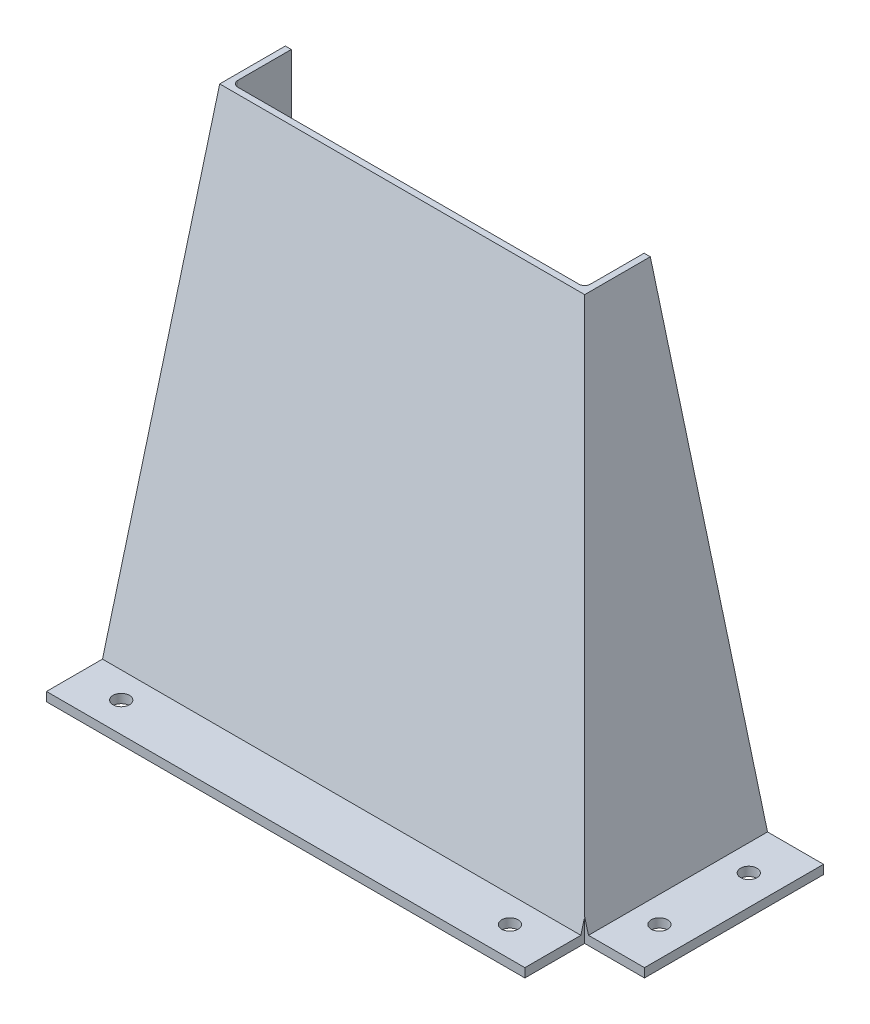
from build123d import *

# Parameters (mm, degrees)
SHELL1_START        = -169
SHELL1_DEPTH        = 196.698454184
BOSS_EXTRUDE1_REACH = 223.544
SKETCH5_W           = 20
SKETCH5_H           = 3
SKETCH6_W           = 20
SKETCH6_H           = 3
BOSS_EXTRUDE2_DEPTH = 79.88011004
CUT_EXTRUDE1_REACH  = 187.712
SKETCH7_W           = 20
SKETCH7_H           = 20
BOSS_EXTRUDE3_DEPTH = 2
FILLET1_R           = 2
CUT_EXTRUDE2_REACH  = 187.712
SKETCH9_R           = 2.75


with BuildPart() as part:
    # Loft1: read off the stored shape, not the designer's step
    # Loft1: loft between two sections, ruled curve by curve
    loft1_from = [
        Edge.make_line((40.035, 150, -9.025), (-80.035, 150, -9.025)),
        Edge.make_line((-80.035, 150, -9.025), (-80.035, 150, -30.975)),
        Edge.make_line((40.035, 150, -30.975), (40.035, 150, -9.025)),
        Edge.make_line((-80.035, 150, -30.975), (40.035, 150, -30.975)),
    ]
    loft1_to = [
        Edge.make_line((80.035, 0, 30.975), (-80.035, 0, 30.975)),
        Edge.make_line((-80.035, 0, 30.975), (-80.035, 0, -30.975)),
        Edge.make_line((80.035, 0, -30.975), (80.035, 0, 30.975)),
        Edge.make_line((-80.035, 0, -30.975), (80.035, 0, -30.975)),
    ]
    loft1 = Solid(Shell([*[Face.make_surface_from_curves(loft1_from[k], loft1_to[k]) for k in range(4)], Face(Wire(loft1_from)), Face(Wire(loft1_to))]))
    add(loft1)

    # Shell1: read off the stored shape, not the designer's step
    # Shell1 outline → Shell1 (cut)
    with BuildSketch(Plane(origin=(0, 0, 0), x_dir=(0.9683714115263207, 0.24108831822232024, -0.06429021819261868), z_dir=(0.2495131446207219, -0.935674292327708, 0.2495131446207219)).offset(SHELL1_START)):
        Polygon((73.640867828, 27.929127254), (-81, 27.929127254), (-81, -31), (77.561825655, -31), (77.490573168, -29.929127254), align=None)
    extrude(amount=SHELL1_DEPTH, mode=Mode.SUBTRACT)

    # Boss-Extrude1: up to this plane
    boss_extrude1_end = Plane(origin=(74.721473029, 19.925726141, 0), z_dir=(0.9662349396012464, 0.2576626505603324, 0))
    # Sketch5 → Boss-Extrude1 (add, up to the surface)
    with BuildSketch(Plane.ZY.offset(80.035), mode=Mode.PRIVATE) as boss_extrude1_sk1:
        with Locations((38.90511004, 1.5)):
            Rectangle(SKETCH5_W, SKETCH5_H)
    boss_extrude1_tool1 = split(extrude(boss_extrude1_sk1.sketch, amount=-BOSS_EXTRUDE1_REACH, mode=Mode.PRIVATE), bisect_by=boss_extrude1_end, keep=Keep.BOTH, mode=Mode.PRIVATE)
    add(boss_extrude1_tool1.solids().sort_by_distance((-80.035, 1.5, 38.90511))[0])

    # Sketch6 → Boss-Extrude2 (add)
    with BuildSketch(Plane(origin=(0, 0, -30.975), x_dir=(-1, 0, 0), z_dir=(0, 0, -1))):
        with Locations((-87.96511004, 1.5)):
            Rectangle(SKETCH6_W, SKETCH6_H)
    extrude(amount=-BOSS_EXTRUDE2_DEPTH)

    # Sketch7 → Cut-Extrude1 (cut, up to next)
    with BuildSketch(Plane(origin=(0, 0, 0), x_dir=(-1, 0, 0), z_dir=(0, -1, 0)), mode=Mode.PRIVATE) as cut_extrude1_sk1:
        with Locations((-87.96511004, -38.90511004)):
            Rectangle(SKETCH7_W, SKETCH7_H)
    cut_extrude1_tool1 = extrude(cut_extrude1_sk1.sketch, amount=-CUT_EXTRUDE1_REACH, mode=Mode.PRIVATE) & part.part
    add(cut_extrude1_tool1.solids().sort_by_distance((87.96511, 0, 38.90511))[0], mode=Mode.SUBTRACT)

    # Sketch8 → Boss-Extrude3 (add)
    with BuildSketch(Plane.ZY.offset(80.035)):
        Polygon((28.90511004, 0), (-30.975, 0), (-30.975, 150), (-11.09488996, 150), (-9.025, 150), (30.175, 3), (48.90511004, 3), (48.90511004, 0), align=None)
    extrude(amount=BOSS_EXTRUDE3_DEPTH)

    # Fillet1
    # the kernel refuses this fillet: 2 mm, written as the material it adds along each edge
    with BuildSketch(Plane(origin=(36.797794865, 154.377431907, -12.262205135), x_dir=(0.06429021819457766, -0.24108831822179794, -0.9683714115263207), z_dir=(0.24951314462072197, -0.9356742923277082, 0.24951314462072197))) as fillet1_piece_1_section:
        with BuildLine():
            CenterArc((FILLET1_R * 0.935674292326, -FILLET1_R), FILLET1_R, 90, 86.193330917)
            Line((-FILLET1_R * 0.0621194550941, -FILLET1_R * 0.933609958504), (0, 0))
            Line((0, 0), (FILLET1_R * 0.935674292326, 0))
        make_face()
    fillet1_piece_1 = extrude(amount=172.943798365, mode=Mode.PRIVATE)
    fillet1_piece_1 = split(fillet1_piece_1, bisect_by=Plane(origin=(36.797794865, 150, -12.262205135), z_dir=(0, -1, 0)), keep=Keep.TOP, mode=Mode.PRIVATE)
    fillet1_piece_1 = split(fillet1_piece_1, bisect_by=Plane(origin=(36.797794865, 0, -12.262205135), z_dir=(0, 1, 0)), keep=Keep.TOP, mode=Mode.PRIVATE)
    add(fillet1_piece_1)
    with BuildSketch(Plane(origin=(-80.035, 154.831174698, -12.383203212), x_dir=(1, 0, 0), z_dir=(0, -0.9662349396012464, 0.2576626505603321))) as fillet1_piece_2_section:
        with BuildLine():
            CenterArc((FILLET1_R, -FILLET1_R), FILLET1_R, 90, 90)
            Line((0, -FILLET1_R), (0, 0))
            Line((0, 0), (FILLET1_R, 0))
        make_face()
    fillet1_piece_2 = extrude(amount=165.241746963, mode=Mode.PRIVATE)
    fillet1_piece_2 = split(fillet1_piece_2, bisect_by=Plane(origin=(-80.035, 150, -12.383203212), z_dir=(0, -1, 0)), keep=Keep.TOP, mode=Mode.PRIVATE)
    fillet1_piece_2 = split(fillet1_piece_2, bisect_by=Plane(origin=(-80.035, 0, -12.383203212), z_dir=(0, 1, 0)), keep=Keep.TOP, mode=Mode.PRIVATE)
    add(fillet1_piece_2)

    # Sketch9 → Cut-Extrude2 (cut, up to next)
    with BuildSketch(Plane.XZ, mode=Mode.PRIVATE) as cut_extrude2_sk1:
        with Locations(Location((87.96511004, -15.975, 0), (0, 0, 270))):
            Circle(SKETCH9_R)
    cut_extrude2_tool1 = extrude(cut_extrude2_sk1.sketch, amount=-CUT_EXTRUDE2_REACH, mode=Mode.PRIVATE) & part.part
    # Sketch9 → Cut-Extrude2 (cut, up to next)
    with BuildSketch(Plane.XZ, mode=Mode.PRIVATE) as cut_extrude2_sk2:
        with Locations(Location((87.96511004, 13.90511004, 0), (0, 0, 270))):
            Circle(SKETCH9_R)
    cut_extrude2_tool2 = extrude(cut_extrude2_sk2.sketch, amount=-CUT_EXTRUDE2_REACH, mode=Mode.PRIVATE) & part.part
    # Sketch9 → Cut-Extrude2 (cut, up to next)
    with BuildSketch(Plane.XZ, mode=Mode.PRIVATE) as cut_extrude2_sk3:
        with Locations(Location((62.96511004, 38.90511004, 0), (0, 0, 270))):
            Circle(SKETCH9_R)
    cut_extrude2_tool3 = extrude(cut_extrude2_sk3.sketch, amount=-CUT_EXTRUDE2_REACH, mode=Mode.PRIVATE) & part.part
    # Sketch9 → Cut-Extrude2 (cut, up to next)
    with BuildSketch(Plane.XZ, mode=Mode.PRIVATE) as cut_extrude2_sk4:
        with Locations(Location((-67.035, 38.90511004, 0), (0, 0, 270))):
            Circle(SKETCH9_R)
    cut_extrude2_tool4 = extrude(cut_extrude2_sk4.sketch, amount=-CUT_EXTRUDE2_REACH, mode=Mode.PRIVATE) & part.part
    add(cut_extrude2_tool1.solids().sort_by_distance((87.96511, 0, -15.975))[0], mode=Mode.SUBTRACT)
    add(cut_extrude2_tool2.solids().sort_by_distance((87.96511, 0, 13.90511))[0], mode=Mode.SUBTRACT)
    add(cut_extrude2_tool3.solids().sort_by_distance((62.96511, 0, 38.90511))[0], mode=Mode.SUBTRACT)
    add(cut_extrude2_tool4.solids().sort_by_distance((-67.035, 0, 38.90511))[0], mode=Mode.SUBTRACT)


solid = part.part
